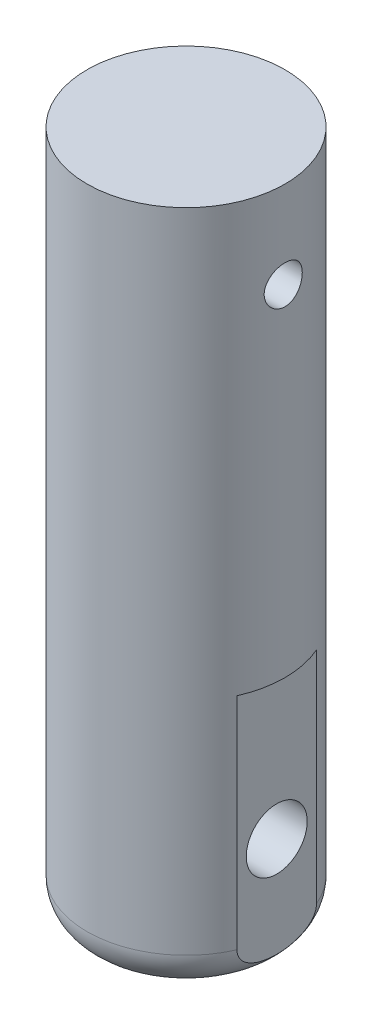
from build123d import *

# Parameters (mm, degrees)
SKETCH_1_R          = 13
EXTRUDE_1_DEPTH     = 90
FILLET_1_R          = 5
SKETCH_3_R          = 4
CUT_EXTRUDE_2_DEPTH = 20
SKETCH_4_W          = 5.638292822
SKETCH_4_H          = 34.801876381
CUT_EXTRUDE_3_DEPTH = 22.5
SKETCH_5_R          = 2.5
CUT_EXTRUDE_1_DEPTH = 55


with BuildPart() as part:
    # Эскиз1 → Вытянуть1 (new body)
    with BuildSketch(Plane(origin=(0, 0, 0), x_dir=(1, 0, 0), z_dir=(0, 1, 0))):
        with Locations((0.959256222, 0)):
            Circle(SKETCH_1_R)
    extrude(amount=EXTRUDE_1_DEPTH)

    # Скругление1
    fillet_1_edges = [part.edges().sort_by_distance(p)[0] for p in [
        (-12.040743778, 0, 0),
    ]]
    fillet(fillet_1_edges, radius=FILLET_1_R)

    # Эскиз3 → Вытянуть2 (cut, symmetric)
    with BuildSketch(Plane(origin=(0, 0, 0), x_dir=(0, 0, -1), z_dir=(1, 0, 0))):
        with Locations((0, 15)):
            Circle(SKETCH_3_R)
    extrude(amount=CUT_EXTRUDE_2_DEPTH, both=True, mode=Mode.SUBTRACT)

    # Эскиз4 → Вытянуть3 (cut, symmetric)
    with BuildSketch(Plane.XY):
        with Locations((-13.576502311, 16.48112444)):
            Rectangle(SKETCH_4_W, SKETCH_4_H)
        with Locations((15.684293194, 16.48112444)):
            Rectangle(SKETCH_4_W, SKETCH_4_H)
    extrude(amount=CUT_EXTRUDE_3_DEPTH, both=True, mode=Mode.SUBTRACT)

    # Эскиз5 → Вырез-Вытянуть1 (cut, symmetric)
    with BuildSketch(Plane(origin=(0, 0, 0), x_dir=(0, 0, -1), z_dir=(1, 0, 0))):
        with Locations((9.34e-07, 78.55964506)):
            Circle(SKETCH_5_R)
    extrude(amount=CUT_EXTRUDE_1_DEPTH, both=True, mode=Mode.SUBTRACT)


solid = part.part
